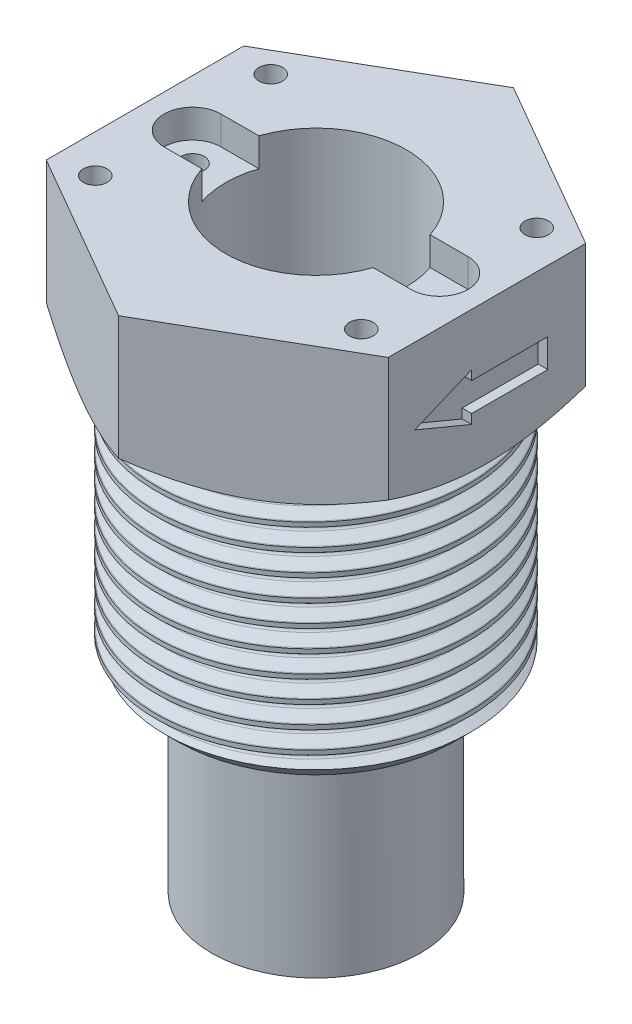
from build123d import *

# Parameters (mm, degrees)
SKETCH_1_W             = 11
SKETCH_1_H             = 65
SKETCH_8_R             = 18.027171515
CUT_EXTRUDE_8_DEPTH    = 2
SKETCH_10_R            = 9.5
CUT_EXTRUDE_10_DEPTH   = 58
SKETCH_11_R            = 7.5
CUT_EXTRUDE_11_DEPTH   = 6
SKETCH_25_R            = 9.5
EXTRUDE_4_DEPTH        = 15
WRAP_START             = -33
WRAP_1_DEPTH           = 1
SKETCH_20_R            = 16.5
SKETCH_20_R_2          = 11
EXTRUDE_3_DEPTH        = 27
CHAMFER_1_SIZE         = 2
SWEEP_2_PITCH          = 2.309
CUT_EXTRUDE_12_DEPTH   = 3
HOLE_WIZARD_M3_1_D     = 2.5
HOLE_WIZARD_M3_1_DEPTH = 10.5
HOLE_WIZARD_M3_1_TIP   = 0.751075774
SKETCH_30_R            = 9.5
CUT_EXTRUDE_13_DEPTH   = 69.738635424


# Read off the part's stored shape, not the designer's step: 包覆1
with BuildPart() as part:
    # 草图1 → 旋转1 (revolve)
    with BuildSketch(Plane.XY, mode=Mode.PRIVATE) as revolve_1_sk:
        with Locations((5.5, 32.5)):
            Rectangle(SKETCH_1_W, SKETCH_1_H)
    revolve(revolve_1_sk.sketch.rotate(Axis((0, 65, 0), (0, -1, 0)), 180), axis=Axis((0, 65, 0), (0, -1, 0)))

    # 草图8 → 切除-拉伸8 (cut)
    with BuildSketch(Plane.XZ):
        Circle(SKETCH_8_R)
    extrude(amount=-CUT_EXTRUDE_8_DEPTH, mode=Mode.SUBTRACT)

    # 草图10 → 切除-拉伸10 (cut)
    with BuildSketch(Plane.XZ.offset(-2)):
        Circle(SKETCH_10_R)
    extrude(amount=-CUT_EXTRUDE_10_DEPTH, mode=Mode.SUBTRACT)

    # 草图11 → 切除-拉伸11 (cut)
    with BuildSketch(Plane(origin=(0, 65, 0), x_dir=(1, 0, 0), z_dir=(0, 1, 0))):
        with Locations(Location((0, 0, 0), (0, 0, 180))):
            Circle(SKETCH_11_R)
    extrude(amount=-CUT_EXTRUDE_11_DEPTH, mode=Mode.SUBTRACT)

    # 草图25 → 凸台-拉伸4 (add)
    with BuildSketch(Plane(origin=(0, 50, 0), x_dir=(1, 0, 0), z_dir=(0, 1, 0))):
        Polygon((0, 20.784609691), (-18, 10.392304845), (-18, -10.392304845), (0, -20.784609691), (18, -10.392304845), (18, 10.392304845), align=None)
        Circle(SKETCH_25_R, mode=Mode.SUBTRACT)
    extrude(amount=EXTRUDE_4_DEPTH)

    # 包覆1 outline → 包覆1 (cut)
    with BuildSketch(Plane(origin=(50, 0, 0), x_dir=(0, 0, -1), z_dir=(1, 0, 0)).offset(WRAP_START)):
        Polygon((-7.607695155, 57), (-1.607695155, 54.5), (-1.607695155, 55.5), (6.392304845, 55.5), (6.392304845, 58.5), (-1.607695155, 58.5), (-1.607695155, 59.5), align=None)
    wrap_1 = extrude(amount=WRAP_1_DEPTH, mode=Mode.SUBTRACT)

    # 镜向1: 包覆1 across plane
    add(wrap_1.mirror(Plane(origin=(0, 0, 0), x_dir=(0, 0, 1), z_dir=(1, 0, 0))), mode=Mode.SUBTRACT)

    # 草图20 → 凸台-拉伸3 (add)
    with BuildSketch(Plane(origin=(0, 50, 0), x_dir=(1, 0, 0), z_dir=(0, 1, 0))):
        with Locations(Location((0, 0, 0), (0, 0, 270))):
            Circle(SKETCH_20_R)
        with Locations(Location((0, 0, 0), (0, 0, 270))):
            Circle(SKETCH_20_R_2, mode=Mode.SUBTRACT)
    extrude(amount=-EXTRUDE_3_DEPTH)

    # 草图21 → 切除-旋转2 (revolve, cut)
    with BuildSketch(Plane(origin=(0, 0, 0), x_dir=(0, 0, -1), z_dir=(1, 0, 0)), mode=Mode.PRIVATE) as cut_revolve_2_sk:
        Polygon((20.784609691, 52), (20.784609691, 50), (17.784609691, 50), align=None)
    revolve(cut_revolve_2_sk.sketch.rotate(Axis((0, 52, 0), (0, 1, 0)), 180), axis=Axis((0, 52, 0), (0, 1, 0)), mode=Mode.SUBTRACT)

    # 倒角1
    chamfer_1_edges = [part.edges().sort_by_distance(p)[0] for p in [
        (0, 23, -16.5),
    ]]
    chamfer(chamfer_1_edges, length=CHAMFER_1_SIZE)

    # 切除-扫描2: the profile of 草图24 screwed along a right-hand helix of 12 turns, 10 arcs to a turn; built about Z, then put on its axis
    sweep_2_z = Axis((0, 0, 0), (0, 0, 1))
    sweep_2_corners = [(16.42937431, 0, -0.590182434), (15.292853797, 0, -1.181817566), (15.122228107, 0, -1.463), (15.292853797, 0, -1.744182434), (16.42937431, 0, -2.335817566), (16.6, 0, -2.617), (16.6, 0, -0.309)]
    with BuildLine(mode=Mode.PRIVATE) as sweep_2_profile:
        Line(sweep_2_corners[0], sweep_2_corners[1])
        Line(sweep_2_corners[3], sweep_2_corners[4])
        Line(sweep_2_corners[5], sweep_2_corners[6])
        ThreePointArc((15.292853797, 0, -1.181817566), (15.168221044, 0, -1.298548877), (15.122228107, 0, -1.463))
        ThreePointArc((15.122228107, 0, -1.463), (15.168221044, 0, -1.627451123), (15.292853797, 0, -1.744182434))
        ThreePointArc((16.42937431, 0, -2.335817566), (16.554007063, 0, -2.452548877), (16.6, 0, -2.617))
        ThreePointArc((16.6, 0, -0.309), (16.554007063, 0, -0.473451123), (16.42937431, 0, -0.590182434))
    sweep_2_cap = Face(sweep_2_profile.wire())
    sweep_2_arcs = [((15.292853797, 0, -1.181817566), (15.122228107, 0, -1.270639678), (15.122228107, 0, -1.463), (1, 0.854911870672946, 1)), ((15.122228107, 0, -1.463), (15.122228107, 0, -1.655360322), (15.292853797, 0, -1.744182434), (1, 0.854911870672946, 1)), ((16.42937431, 0, -2.335817566), (16.6, 0, -2.424639678), (16.6, 0, -2.617), (1, 0.8549118706729456, 1)), ((16.6, 0, -0.309), (16.6, 0, -0.501360322), (16.42937431, 0, -0.590182434), (1, 0.8549118706729619, 1))]  # start, shoulder, end, weights
    sweep_2_turn_angles = [0, 18, 36, 54, 72, 90, 108, 126, 144, 162, 180, 198, 216, 234, 252, 270, 288, 306, 324, 342, 360]
    sweep_2_turn_weights = [1, 0.9510565162951535, 1, 0.9510565162951535, 1, 0.9510565162951535, 1, 0.9510565162951535, 1, 0.9510565162951535, 1, 0.9510565162951535, 1, 0.9510565162951535, 1, 0.9510565162951535, 1, 0.9510565162951535, 1, 0.9510565162951535, 1]
    sweep_2_turn_rails = [Edge.make_bspline([Vector(p[0], p[1], 0).rotate(sweep_2_z, sweep_2_turn_angles[k]) / sweep_2_turn_weights[k] + Vector(0, 0, p[2] + SWEEP_2_PITCH * sweep_2_turn_angles[k] / 360) for k in range(21)], [0, 0, 0, 1, 1, 2, 2, 3, 3, 4, 4, 5, 5, 6, 6, 7, 7, 8, 8, 9, 9, 10, 10, 10], 2, sweep_2_turn_weights) for p in sweep_2_corners]
    sweep_2_turn_sides = [*[Face.make_surface_from_curves(sweep_2_turn_rails[p[0]], sweep_2_turn_rails[p[1]]) for p in [(0, 1), (3, 4), (5, 6)]], *[Face.make_bezier_surface([[Vector(p[j][0], p[j][1], 0).rotate(sweep_2_z, sweep_2_turn_angles[2 * i + k]) / sweep_2_turn_weights[2 * i + k] + Vector(0, 0, p[j][2] + SWEEP_2_PITCH * sweep_2_turn_angles[2 * i + k] / 360) for k in range(3)] for j in range(3)], [[p[3][j] * sweep_2_turn_weights[2 * i + k] for k in range(3)] for j in range(3)]) for p in sweep_2_arcs for i in range(10)]]
    sweep_2 = Plane(origin=(0, 23, 0), x_dir=(0, 0, -1), z_dir=(0, 1, 0)) * Solid(Shell([*[p.moved(Location((0, 0, SWEEP_2_PITCH * i))) for i in range(12) for p in sweep_2_turn_sides], sweep_2_cap, sweep_2_cap.rotate(sweep_2_z, 4320).moved(Location((0, 0, SWEEP_2_PITCH * 4320 / 360)))]))
    add(sweep_2, mode=Mode.SUBTRACT)

    # 草图27 → 切除-拉伸12 (cut)
    with BuildSketch(Plane(origin=(0, 65, 0), x_dir=(1, 0, 0), z_dir=(0, 1, 0))):
        with BuildLine():
            Line((-13, 3), (13, 3))
            ThreePointArc((13, 3), (16, 0), (13, -3))
            Line((13, -3), (-13, -3))
            ThreePointArc((-13, -3), (-16, 0), (-13, 3))
        make_face()
    extrude(amount=-CUT_EXTRUDE_12_DEPTH, mode=Mode.SUBTRACT)

    # M3 螺纹孔1
    with Locations(Plane(origin=(0, 65, 0), x_dir=(1, 0, 0), z_dir=(0, 1, 0))):
        with Locations((-14, 9.237604307), (-14, -9.237604307), (14, -9.237604307), (14, 9.237604307), (-13, 0), (13, 0)):
            Hole(HOLE_WIZARD_M3_1_D / 2, depth=HOLE_WIZARD_M3_1_DEPTH)
            with Locations((0, 0, -(HOLE_WIZARD_M3_1_DEPTH + HOLE_WIZARD_M3_1_TIP / 2))):  # 118° drill point
                Cone(0, HOLE_WIZARD_M3_1_D / 2, HOLE_WIZARD_M3_1_TIP, mode=Mode.SUBTRACT)

    # 草图30 → 切除-拉伸13 (cut, through all)
    with BuildSketch(Plane(origin=(0, 65, 0), x_dir=(1, 0, 0), z_dir=(0, 1, 0))):
        Circle(SKETCH_30_R)
    extrude(amount=-CUT_EXTRUDE_13_DEPTH, mode=Mode.SUBTRACT)


solid = part.part
